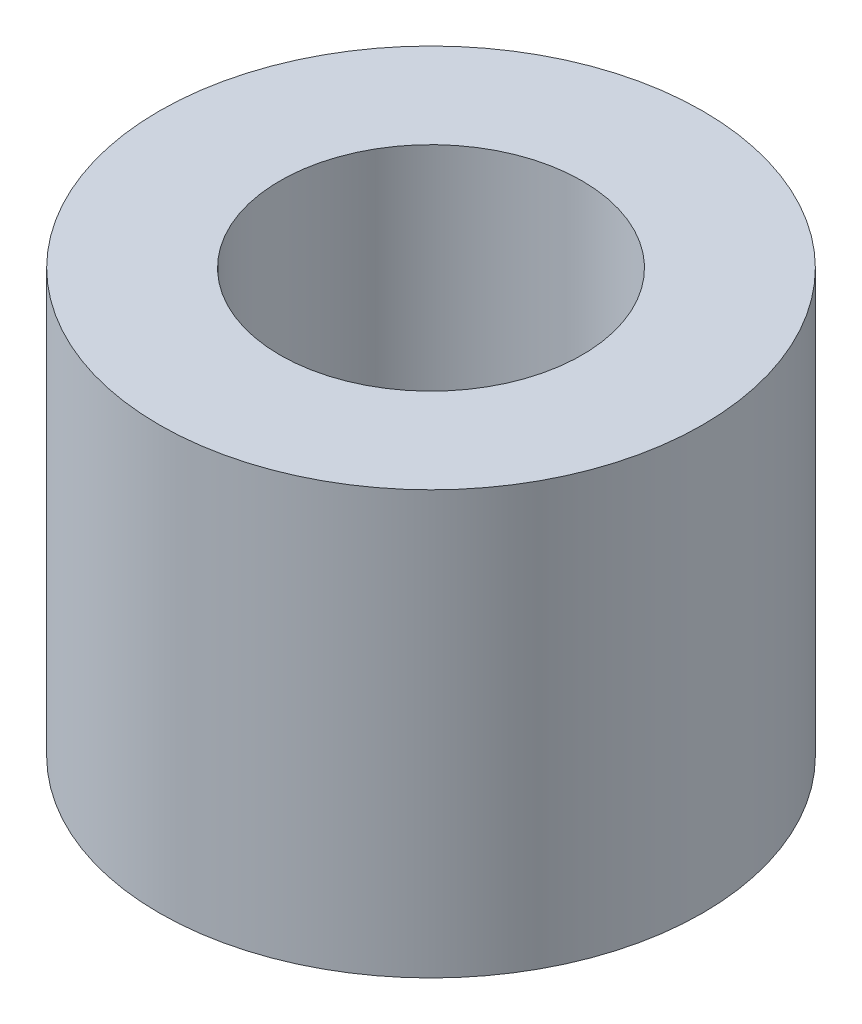
from build123d import *

# Parameters (mm, degrees)
SKETCH1_R           = 5.715
SKETCH1_R_2         = 3.175
BOSS_EXTRUDE1_DEPTH = 8.89


with BuildPart() as part:
    # Sketch1 → Boss-Extrude1 (new body)
    with BuildSketch(Plane(origin=(0, 0, 0), x_dir=(1, 0, 0), z_dir=(0, 1, 0))):
        Circle(SKETCH1_R)
        Circle(SKETCH1_R_2, mode=Mode.SUBTRACT)
    extrude(amount=BOSS_EXTRUDE1_DEPTH)


solid = part.part
